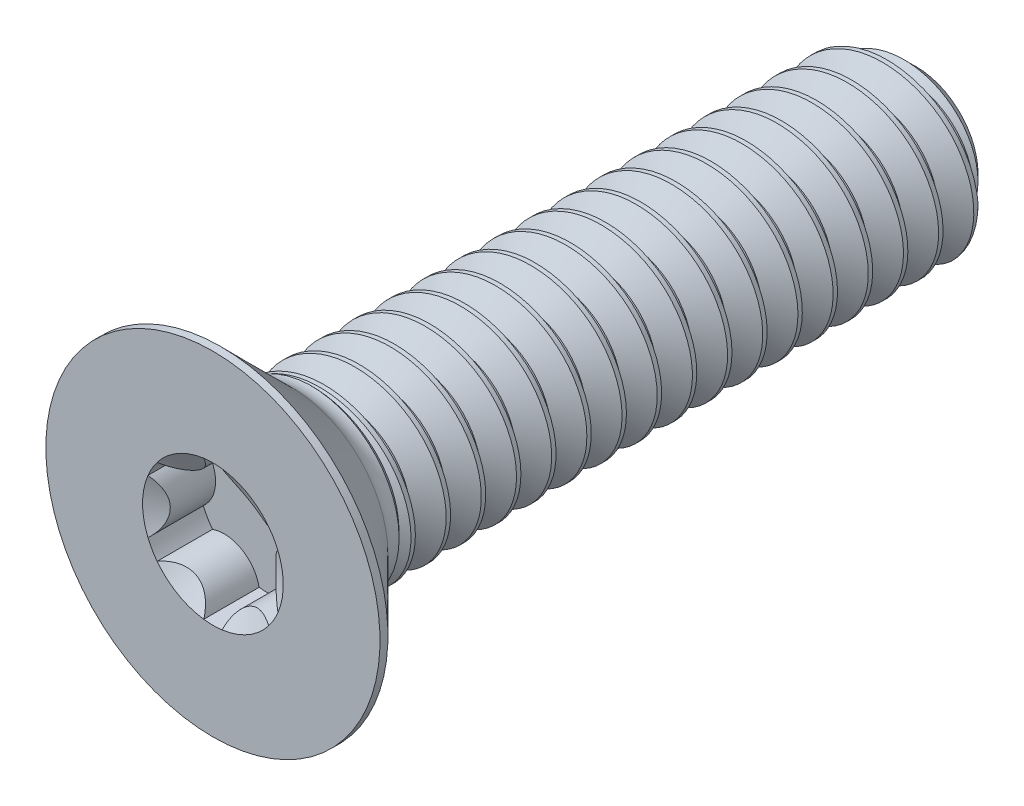
from build123d import *

# Parameters (mm, degrees)
SKETCH1_W          = 8
SKETCH1_H          = 1
CHAMFER1_SIZE      = 0.3
CUT_SWEEP1_PITCH   = 0.4
CUT_EXTRUDE2_DEPTH = 0.63
CIRPATTERN1_COUNT  = 6


with BuildPart() as part:
    # Sketch1 → Revolve1 (revolve)
    with BuildSketch(Plane(origin=(0, 0, 0), x_dir=(0, 0, -1), z_dir=(1, 0, 0))):
        with Locations((4, 0.5)):
            Rectangle(SKETCH1_W, SKETCH1_H)
    revolve(axis=Axis((0, 0, -8), (0, 0, 1)))

    # Chamfer1
    chamfer1_edges = [part.edges().sort_by_distance(p)[0] for p in [
        (0, -1, -8),
    ]]
    chamfer(chamfer1_edges, length=CHAMFER1_SIZE)

    # Cut-Sweep1: the profile of Sketch2 profile screwed along a right-hand helix of 20 turns, 6 arcs to a turn; built about Z, then put on its axis
    cut_sweep1_z = Axis((0, 0, 0), (0, 0, 1))
    cut_sweep1_corners = [(1.0006, 0, 0.00034641), (1.0006, 0, -0.35034641), (0.740192379, 0, -0.2), (0.740192379, 0, -0.15)]
    with BuildLine(mode=Mode.PRIVATE) as cut_sweep1_profile:
        Line(cut_sweep1_corners[0], cut_sweep1_corners[1])
        Line(cut_sweep1_corners[1], cut_sweep1_corners[2])
        Line(cut_sweep1_corners[2], cut_sweep1_corners[3])
        Line(cut_sweep1_corners[3], cut_sweep1_corners[0])
    cut_sweep1_cap = Face(cut_sweep1_profile.wire())
    cut_sweep1_turn_angles = [0, 30, 60, 90, 120, 150, 180, 210, 240, 270, 300, 330, 360]
    cut_sweep1_turn_weights = [1, 0.8660254037844387, 1, 0.8660254037844387, 1, 0.8660254037844387, 1, 0.8660254037844387, 1, 0.8660254037844387, 1, 0.8660254037844387, 1]
    cut_sweep1_turn_rails = [Edge.make_bspline([Vector(p[0], p[1], 0).rotate(cut_sweep1_z, cut_sweep1_turn_angles[k]) / cut_sweep1_turn_weights[k] + Vector(0, 0, p[2] + CUT_SWEEP1_PITCH * cut_sweep1_turn_angles[k] / 360) for k in range(13)], [0, 0, 0, 1, 1, 2, 2, 3, 3, 4, 4, 5, 5, 6, 6, 6], 2, cut_sweep1_turn_weights) for p in cut_sweep1_corners]
    cut_sweep1_turn_sides = [Face.make_surface_from_curves(cut_sweep1_turn_rails[p[0]], cut_sweep1_turn_rails[p[1]]) for p in [(0, 1), (1, 2), (2, 3), (3, 0)]]
    cut_sweep1 = Plane(origin=(0, 0, -8), x_dir=(0, 1, 0), z_dir=(0, 0, 1)) * Solid(Shell([*[p.moved(Location((0, 0, CUT_SWEEP1_PITCH * i))) for i in range(20) for p in cut_sweep1_turn_sides], cut_sweep1_cap, cut_sweep1_cap.rotate(cut_sweep1_z, 7200).moved(Location((0, 0, CUT_SWEEP1_PITCH * 7200 / 360)))]))
    add(cut_sweep1, mode=Mode.SUBTRACT)

    # Sketch7 → Revolve2 (revolve)
    with BuildSketch(Plane(origin=(0, 0, 0), x_dir=(0, 0, -1), z_dir=(1, 0, 0)), mode=Mode.PRIVATE) as revolve2_sk:
        with BuildLine():
            Line((0, 1.9), (0.09, 1.9))
            Line((0.09, 1.9), (0.9, 1.09))
            ThreePointArc((0.9, 1.09), (0.999688554, 1.023390238), (1.117279221, 1))
            Line((1.117279221, 1), (1.117279221, 0))
            Line((1.117279221, 0), (0, 0))
            Line((0, 0), (0, 1.9))
        make_face()
    revolve(revolve2_sk.sketch.rotate(Axis((0, 0, 0), (0, 0, -1)), 189.336081704), axis=Axis((0, 0, 0), (0, 0, -1)))

    # Boss-Extrude1 cone 1 section (through the dimple's axis) → Boss-Extrude1 (revolve)
    with BuildSketch(Plane(origin=(0, 0, -1.117279221), x_dir=(0, -1, 0), z_dir=(1, 0, 0))):
        Polygon((0, 0), (1, 0), (0, 0.965688775), align=None)
    revolve(axis=Axis((0, 0, -1.117279221), (0, 0, -1)))

    # Sketch5 → Cut-Extrude2 (cut)
    with BuildSketch(Plane.XY):
        with BuildLine():
            Line((-0.692820323, -0.4), (0, 0))
            Line((0, 0), (-0.692820323, 0.4))
            ThreePointArc((-0.692820323, 0.4), (-0.717498193, 0.353830952), (-0.739103626, 0.306146746))
            ThreePointArc((-0.739103626, 0.306146746), (-0.6, 0), (-0.739103626, -0.306146746))
            ThreePointArc((-0.739103626, -0.306146746), (-0.717498193, -0.353830952), (-0.692820323, -0.4))
        make_face()
    cut_extrude2 = extrude(amount=-CUT_EXTRUDE2_DEPTH, mode=Mode.SUBTRACT)

    # CirPattern1: Cut-Extrude2 ×6 about axis
    cirpattern1_axis = Axis((0, 0, 0), (0, 0, 1))
    for i in range(1, CIRPATTERN1_COUNT):
        add(cut_extrude2.rotate(cirpattern1_axis, i * 360 / CIRPATTERN1_COUNT), mode=Mode.SUBTRACT)

    # Cut-Extrude3 cone 1 section (through the dimple's axis) → Cut-Extrude3 (revolve, cut)
    with BuildSketch(Plane(origin=(0, 0, 0), x_dir=(0, -1, 0), z_dir=(1, 0, 0))):
        Polygon((0, 0), (0.8, 0), (0, 0.461880215), align=None)
    revolve(axis=Axis((0, 0, 0), (0, 0, -1)), mode=Mode.SUBTRACT)


solid = part.part
